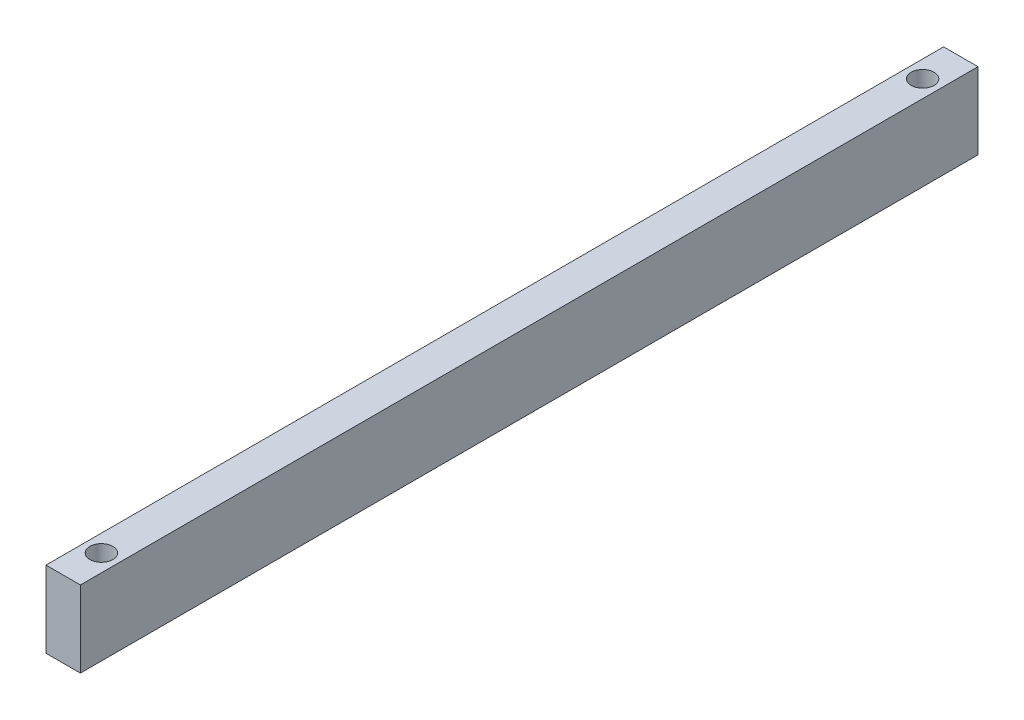
from build123d import *

# Parameters (mm, degrees)
SKETCH1_W           = 9
SKETCH1_H           = 20
BOSS_EXTRUDE1_DEPTH = 117.5
SKETCH3_R           = 3
CUT_EXTRUDE2_DEPTH  = 120.27489258


with BuildPart() as part:
    # Sketch1 → Boss-Extrude1 (new, symmetric)
    with BuildSketch(Plane.XY):
        Rectangle(SKETCH1_W, SKETCH1_H)
    extrude(amount=BOSS_EXTRUDE1_DEPTH, both=True)

    # Sketch3 → Cut-Extrude2 (cut, through all)
    with BuildSketch(Plane(origin=(0, 10, 0), x_dir=(1, 0, 0), z_dir=(0, 1, 0))):
        with Locations((0, -107.5)):
            Circle(SKETCH3_R)
    cut_extrude2 = extrude(amount=-CUT_EXTRUDE2_DEPTH, mode=Mode.SUBTRACT)

    # Mirror2: Cut-Extrude2 across plane
    add(cut_extrude2.mirror(Plane.XY), mode=Mode.SUBTRACT)


solid = part.part
